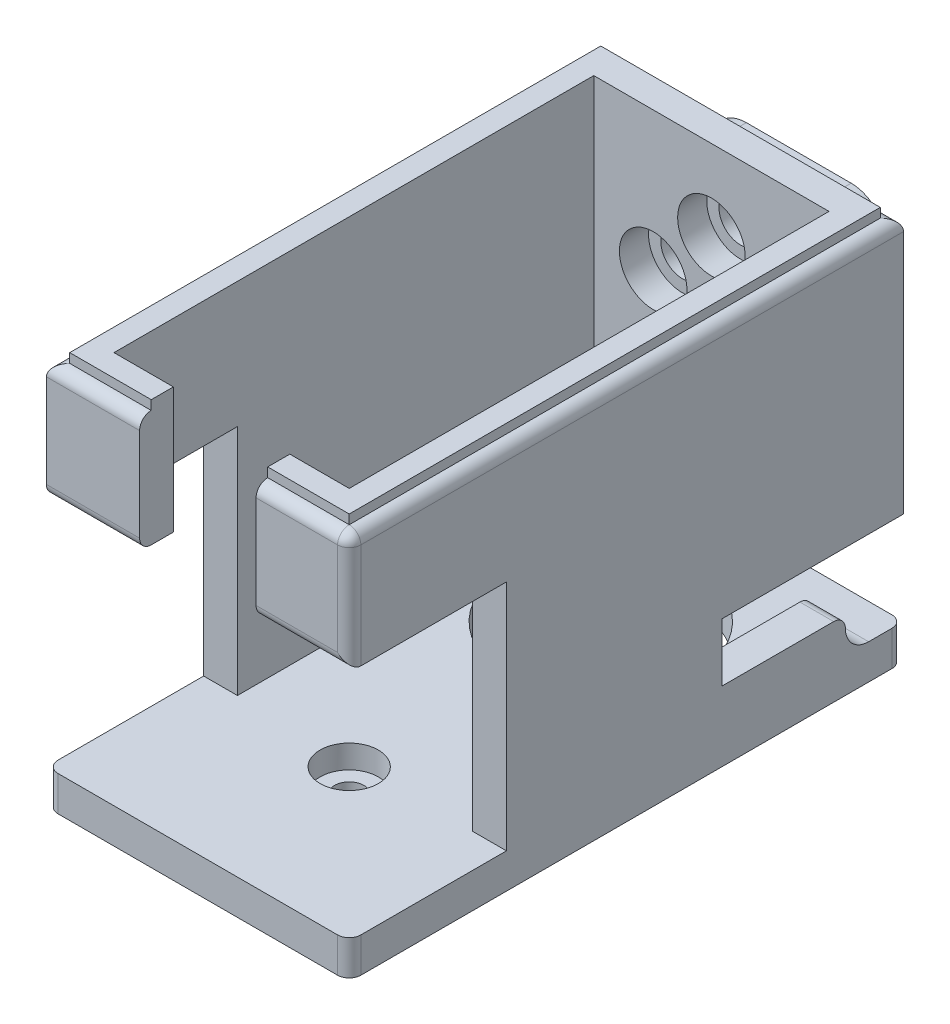
from build123d import *

# Parameters (mm, degrees)
BOSS_EXTRUDE1_DEPTH      = 10
SKETCH2_W                = 20
SKETCH2_H                = 17
BOSS_EXTRUDE2_DEPTH      = 3
SKETCH3_W                = 26
SKETCH3_H                = 47
BOSS_EXTRUDE3_DEPTH      = 3
SKETCH5_R                = 8
SKETCH5_W                = 16
SKETCH5_H                = 4
CUT_EXTRUDE1_DEPTH       = 41.264748851
BOSS_EXTRUDE4_DEPTH      = 26
SKETCH7_W                = 20
SKETCH7_H                = 10.5
CUT_EXTRUDE2_DEPTH       = 10
SKETCH9_W                = 8
SKETCH9_H                = 6
CUT_EXTRUDE3_DEPTH       = 10
SKETCH10_W               = 30
SKETCH10_H               = 30
BOSS_EXTRUDE5_DEPTH      = 3
SKETCH11_R               = 1.75
CUT_EXTRUDE4_DEPTH       = 5
BOSS_EXTRUDE6_START      = 3
SKETCH12_W               = 26
SKETCH12_H               = 47
SKETCH12_R               = 8
BOSS_EXTRUDE6_DEPTH      = 3
CUT_EXTRUDE5_START       = -3
SKETCH14_R               = 8
SKETCH14_W               = 16
SKETCH14_H               = 4
CUT_EXTRUDE5_DEPTH       = 3
CUT_EXTRUDE7_DEPTH       = 49.674942219
CUT_EXTRUDE7_DEPTH_BACK  = 49.674942219
BOSS_EXTRUDE7_DEPTH      = 10.7
SKETCH18_W               = 15
SKETCH18_H               = 5
CUT_EXTRUDE8_DEPTH       = 10
SKETCH21_R               = 1.85
CUT_EXTRUDE9_DEPTH       = 5
SKETCH22_R               = 2.9
CUT_EXTRUDE10_DEPTH      = 2.6
BOSS_EXTRUDE11_OUTLINE_R = 1.85
BOSS_EXTRUDE11_DEPTH     = 0.6
SKETCH24_R               = 1.85
BOSS_EXTRUDE12_DEPTH     = 4
SKETCH25_W               = 7
SKETCH25_H               = 3
CUT_EXTRUDE11_DEPTH      = 5
SKETCH26_W               = 20.2
SKETCH26_H               = 41.2
CUT_EXTRUDE12_DEPTH      = 30
SKETCH27_W               = 0.1
SKETCH27_H               = 3
CUT_EXTRUDE13_DEPTH      = 55.440426156
SKETCH28_R               = 8
CUT_EXTRUDE14_DEPTH      = 46.250524859
SKETCH29_W               = 2.9
SKETCH29_H               = 3
CUT_EXTRUDE15_DEPTH      = 5
FILLET1_R                = 2
FILLET2_R                = 2
FILLET3_R                = 1
BOSS_EXTRUDE13_START     = -5
SKETCH35_R               = 8
SKETCH35_R_2             = 2.5
BOSS_EXTRUDE13_DEPTH     = 5
BOSS_EXTRUDE14_DEPTH     = 0.8
SKETCH38_R               = 2.55
SKETCH38_R_2             = 2.5
CUT_EXTRUDE16_DEPTH      = 2
SKETCH39_R               = 2.55
SKETCH39_R_2             = 1.25
BOSS_EXTRUDE15_DEPTH     = 1
SKETCH40_R               = 8
SKETCH40_R_2             = 6.5
CUT_EXTRUDE17_DEPTH      = 4


# Read off the part's stored shape, not the designer's step: Boss-Extrude11
with BuildPart() as part:
    # Sketch1 → Boss-Extrude1 (new body)
    with BuildSketch(Plane(origin=(0, 0, 0), x_dir=(1, 0, 0), z_dir=(0, 1, 0))):
        Polygon((5, -23.5), (13, -23.5), (13, 23.5), (-13, 23.5), (-13, -23.5), (-5, -23.5), (-5, -20.5), (-10, -20.5), (-10, 20.5), (10, 20.5), (10, -20.5), (5, -20.5), align=None)
    extrude(amount=BOSS_EXTRUDE1_DEPTH)

    # Sketch2 → Boss-Extrude2 (add)
    with BuildSketch(Plane(origin=(13, 0, 0), x_dir=(0, 0, -1), z_dir=(1, 0, 0))):
        with Locations((0, -8.5)):
            Rectangle(SKETCH2_W, SKETCH2_H)
    boss_extrude2 = extrude(amount=-BOSS_EXTRUDE2_DEPTH)

    # Mirror1: Boss-Extrude2 across plane
    add(boss_extrude2.mirror(Plane(origin=(0, 0, 0), x_dir=(0, 0, 1), z_dir=(1, 0, 0))))

    # Sketch3 → Boss-Extrude3 (add)
    with BuildSketch(Plane.XZ.offset(17)):
        Rectangle(SKETCH3_W, SKETCH3_H)
    extrude(amount=BOSS_EXTRUDE3_DEPTH)

    # Sketch5 → Cut-Extrude1 (cut, through all)
    with BuildSketch(Plane.XZ.offset(20)):
        with Locations(Location((0, 10.5, 0), (0, 0, 270))):
            Circle(SKETCH5_R)
        with Locations((0, -6.5)):
            Rectangle(SKETCH5_W, SKETCH5_H)
        with Locations((0, -14.5)):
            Rectangle(SKETCH5_W, SKETCH5_H)
    extrude(amount=-CUT_EXTRUDE1_DEPTH, mode=Mode.SUBTRACT)

    # Sketch6 → Boss-Extrude4 (add)
    with BuildSketch(Plane(origin=(13, 0, 0), x_dir=(0, 0, -1), z_dir=(1, 0, 0))):
        Polygon((29.5, 4.35), (23.5, 4.35), (23.5, 0), (23.5, -3.65), (29.5, -3.65), align=None)
        Polygon((23.5, -3.65), (23.5, 0), (10, 0), (10, -9.3), (23.5, -9.3), align=None)
    extrude(amount=-BOSS_EXTRUDE4_DEPTH)

    # Sketch7 → Cut-Extrude2 (cut)
    with BuildSketch(Plane(origin=(0, 0, 0), x_dir=(1, 0, 0), z_dir=(0, 1, 0))):
        with Locations((0, 15.25)):
            Rectangle(SKETCH7_W, SKETCH7_H)
    extrude(amount=-CUT_EXTRUDE2_DEPTH, mode=Mode.SUBTRACT)

    # Sketch9 → Cut-Extrude3 (cut)
    with BuildSketch(Plane(origin=(0, 4.35, 0), x_dir=(1, 0, 0), z_dir=(0, 1, 0))):
        with Locations((-9, 26.5)):
            Rectangle(SKETCH9_W, SKETCH9_H)
        with Locations((9, 26.5)):
            Rectangle(SKETCH9_W, SKETCH9_H)
    extrude(amount=-CUT_EXTRUDE3_DEPTH, mode=Mode.SUBTRACT)

    # Sketch10 → Boss-Extrude5 (add)
    with BuildSketch(Plane(origin=(0, 0, -29.5), x_dir=(-1, 0, 0), z_dir=(0, 0, -1))):
        Rectangle(SKETCH10_W, SKETCH10_H)
    extrude(amount=BOSS_EXTRUDE5_DEPTH)

    # Sketch11 → Cut-Extrude4 (cut)
    with BuildSketch(Plane(origin=(0, 0, -32.5), x_dir=(-1, 0, 0), z_dir=(0, 0, -1))):
        with Locations((0, 10)):
            Circle(SKETCH11_R)
        with Locations((10, 0)):
            Circle(SKETCH11_R)
        with Locations((0, -10)):
            Circle(SKETCH11_R)
        with Locations((-10, 0)):
            Circle(SKETCH11_R)
    extrude(amount=-CUT_EXTRUDE4_DEPTH, mode=Mode.SUBTRACT)

    # Sketch12 → Boss-Extrude6 (add)
    with BuildSketch(Plane.XZ.offset(20).offset(BOSS_EXTRUDE6_START)):
        Rectangle(SKETCH12_W, SKETCH12_H)
        with Locations(Location((0, 10.5, 0), (0, 0, 270))):
            Circle(SKETCH12_R, mode=Mode.SUBTRACT)
    extrude(amount=-BOSS_EXTRUDE6_DEPTH)

    # Sketch14 → Cut-Extrude5 (cut)
    with BuildSketch(Plane(origin=(0, -17, 0), x_dir=(1, 0, 0), z_dir=(0, 1, 0)).offset(CUT_EXTRUDE5_START)):
        Polygon((13, -23.5), (13, -10), (10, -10), (10, 10), (13, 10), (13, 23.5), (-13, 23.5), (-13, 10), (-10, 10), (-10, -10), (-13, -10), (-13, -23.5), align=None)
        with Locations(Location((0, -10.5, 0), (0, 0, 90))):
            Circle(SKETCH14_R, mode=Mode.SUBTRACT)
        with Locations((0, 6.5)):
            Rectangle(SKETCH14_W, SKETCH14_H, mode=Mode.SUBTRACT)
        with Locations((0, 14.5)):
            Rectangle(SKETCH14_W, SKETCH14_H, mode=Mode.SUBTRACT)
    extrude(amount=CUT_EXTRUDE5_DEPTH, mode=Mode.SUBTRACT)

    # Sketch15 → Cut-Extrude7 (cut, two sides: drawn at the far end of the back side and taken through both)
    with BuildSketch(Plane(origin=(13, 0, 0), x_dir=(0, 0, -1), z_dir=(1, 0, 0)).offset(-CUT_EXTRUDE7_DEPTH_BACK)):
        Polygon((23.5, -9.3), (23.5, -15.243835525), (32.5, -15.243835525), (32.5, 15), (23.5, 15), (23.5, 10), align=None)
    extrude(amount=CUT_EXTRUDE7_DEPTH + CUT_EXTRUDE7_DEPTH_BACK, mode=Mode.SUBTRACT)

    # Sketch16 → Boss-Extrude7 (add)
    with BuildSketch(Plane.XZ.offset(9.3)):
        Polygon((10, -10), (10, -20.5), (-10, -20.5), (-10, -10), (-13, -10), (-13, -23.5), (13, -23.5), (13, -10), align=None)
    extrude(amount=BOSS_EXTRUDE7_DEPTH)

    # Sketch18 → Cut-Extrude8 (cut)
    with BuildSketch(Plane(origin=(13, 0, 0), x_dir=(0, 0, -1), z_dir=(1, 0, 0))):
        with Locations((16, -14.5)):
            Rectangle(SKETCH18_W, SKETCH18_H)
    cut_extrude8 = extrude(amount=-CUT_EXTRUDE8_DEPTH, mode=Mode.SUBTRACT)

    # Mirror2: Cut-Extrude8 across plane
    add(cut_extrude8.mirror(Plane(origin=(0, 0, 0), x_dir=(0, 0, 1), z_dir=(1, 0, 0))), mode=Mode.SUBTRACT)

    # Sketch21 → Cut-Extrude9 (cut)
    with BuildSketch(Plane(origin=(0, 0, -23.5), x_dir=(-1, 0, 0), z_dir=(0, 0, -1))):
        with Locations((-5, -1.15)):
            Circle(SKETCH21_R)
        with Locations((0, 3.85)):
            Circle(SKETCH21_R)
        with Locations((5, -1.15)):
            Circle(SKETCH21_R)
        with Locations((0, -6.15)):
            Circle(SKETCH21_R)
    extrude(amount=-CUT_EXTRUDE9_DEPTH, mode=Mode.SUBTRACT)

    # Sketch22 → Cut-Extrude10 (cut)
    with BuildSketch(Plane.XY.offset(-20.5)):
        with Locations((0, 3.85)):
            Circle(SKETCH22_R)
        with Locations((5, -1.15)):
            Circle(SKETCH22_R)
        with Locations((0, -6.15)):
            Circle(SKETCH22_R)
        with Locations((-5, -1.15)):
            Circle(SKETCH22_R)
    extrude(amount=-CUT_EXTRUDE10_DEPTH, mode=Mode.SUBTRACT)

    # Boss-Extrude11 outline → Boss-Extrude11 (add)
    with BuildSketch(Plane(origin=(0, 0, -23.5), x_dir=(-1, 0, 0), z_dir=(0, 0, -1))):
        Polygon((-13, -12), (-3, -12), (-3, -17), (-13, -17), (-13, -23), (13, -23), (13, -17), (3, -17), (3, -12), (13, -12), (13, 10), (-13, 10), align=None)
        with Locations((-5, -1.15)):
            Circle(BOSS_EXTRUDE11_OUTLINE_R, mode=Mode.SUBTRACT)
        with Locations((0, -6.15)):
            Circle(BOSS_EXTRUDE11_OUTLINE_R, mode=Mode.SUBTRACT)
        with Locations((5, -1.15)):
            Circle(BOSS_EXTRUDE11_OUTLINE_R, mode=Mode.SUBTRACT)
        with Locations((0, 3.85)):
            Circle(BOSS_EXTRUDE11_OUTLINE_R, mode=Mode.SUBTRACT)
    extrude(amount=BOSS_EXTRUDE11_DEPTH)

    # Sketch24 → Boss-Extrude12 (add)
    with BuildSketch(Plane(origin=(0, 0, -24.1), x_dir=(-1, 0, 0), z_dir=(0, 0, -1))):
        with BuildLine():
            ThreePointArc((-7.5, 3.35), (-6.621320344, 5.471320344), (-4.5, 6.35))
            Line((-4.5, 6.35), (4.5, 6.35))
            ThreePointArc((4.5, 6.35), (6.621320344, 5.471320344), (7.5, 3.35))
            Line((7.5, 3.35), (7.5, -5.65))
            ThreePointArc((7.5, -5.65), (6.621320344, -7.771320344), (4.5, -8.65))
            Line((4.5, -8.65), (-4.5, -8.65))
            ThreePointArc((-4.5, -8.65), (-6.621320344, -7.771320344), (-7.5, -5.65))
            Line((-7.5, -5.65), (-7.5, 3.35))
        make_face()
        with Locations((0, -6.15)):
            Circle(SKETCH24_R, mode=Mode.SUBTRACT)
        with Locations((5, -1.15)):
            Circle(SKETCH24_R, mode=Mode.SUBTRACT)
        with Locations((-5, -1.15)):
            Circle(SKETCH24_R, mode=Mode.SUBTRACT)
        with Locations((0, 3.85)):
            Circle(SKETCH24_R, mode=Mode.SUBTRACT)
    extrude(amount=BOSS_EXTRUDE12_DEPTH)

    # Sketch25 → Cut-Extrude11 (cut)
    with BuildSketch(Plane(origin=(0, 0, -24.1), x_dir=(-1, 0, 0), z_dir=(0, 0, -1))):
        with Locations((-6.5, -18.5)):
            Rectangle(SKETCH25_W, SKETCH25_H)
        with Locations((6.5, -18.5)):
            Rectangle(SKETCH25_W, SKETCH25_H)
    extrude(amount=-CUT_EXTRUDE11_DEPTH, mode=Mode.SUBTRACT)

    # Sketch26 → Cut-Extrude12 (cut)
    with BuildSketch(Plane(origin=(0, 10, 0), x_dir=(1, 0, 0), z_dir=(0, 1, 0))):
        Rectangle(SKETCH26_W, SKETCH26_H)
    extrude(amount=-CUT_EXTRUDE12_DEPTH, mode=Mode.SUBTRACT)

    # Sketch27 → Cut-Extrude13 (cut, through all)
    with BuildSketch(Plane(origin=(0, 0, -24.1), x_dir=(-1, 0, 0), z_dir=(0, 0, -1))):
        with Locations((-10.05, -18.5)):
            Rectangle(SKETCH27_W, SKETCH27_H)
        with Locations((10.05, -18.5)):
            Rectangle(SKETCH27_W, SKETCH27_H)
    extrude(amount=-CUT_EXTRUDE13_DEPTH, mode=Mode.SUBTRACT)

    # Sketch28 → Cut-Extrude14 (cut, through all)
    with BuildSketch(Plane.XZ.offset(23)):
        with Locations(Location((0, -11.1, 0), (0, 0, 270))):
            Circle(SKETCH28_R)
    extrude(amount=-CUT_EXTRUDE14_DEPTH, mode=Mode.SUBTRACT)

    # Sketch29 → Cut-Extrude15 (cut)
    with BuildSketch(Plane(origin=(0, 0, -24.1), x_dir=(-1, 0, 0), z_dir=(0, 0, -1))):
        with Locations((-11.55, -18.5)):
            Rectangle(SKETCH29_W, SKETCH29_H)
        with Locations((11.55, -18.5)):
            Rectangle(SKETCH29_W, SKETCH29_H)
    extrude(amount=-CUT_EXTRUDE15_DEPTH, mode=Mode.SUBTRACT)

    # Fillet1
    fillet1_edges = [part.edges().sort_by_distance(p)[0] for p in [
        (-3, -20, -22.35),
        (3, -20, -22.35),
    ]]
    fillet(fillet1_edges, radius=FILLET1_R)

    # Fillet2
    fillet2_edges = [part.edges().sort_by_distance(p)[0] for p in [
        (11.55, -20, -19.1),
        (-11.55, -20, -19.1),
    ]]
    fillet(fillet2_edges, radius=FILLET2_R)

    # Fillet3
    fillet3_edges = [part.edges().sort_by_distance(p)[0] for p in [
        (11.55, -17, -19.1),
        (-11.55, -17, -19.1),
        (-9, 10, 23.5),
        (-13, 10, -0.3),
        (0, 10, -24.1),
        (13, 10, -0.3),
        (9, 10, 23.5),
        (13, 5, 23.5),
        (9, 0, 23.5),
        (-9, 0, 23.5),
        (13, -21.5, -24.1),
        (-13, -21.5, -24.1),
        (-13, -21.5, 23.5),
        (13, -21.5, 23.5),
    ]]
    fillet(fillet3_edges, radius=FILLET3_R - 0.0001)  # a hair under: the kernel refuses the full size

    # Sketch35 → Boss-Extrude13 (add)
    with BuildSketch(Plane(origin=(0, -20, 0), x_dir=(1, 0, 0), z_dir=(0, 1, 0)).offset(BOSS_EXTRUDE13_START)):
        with Locations(Location((0, -10.5, 0), (0, 0, 270))):
            Circle(SKETCH35_R)
        with Locations(Location((0, -10.5, 0), (0, 0, 270))):
            Circle(SKETCH35_R_2, mode=Mode.SUBTRACT)
    extrude(amount=BOSS_EXTRUDE13_DEPTH)

    # Sketch36 → Boss-Extrude14 (add)
    with BuildSketch(Plane(origin=(0, 10, 0), x_dir=(1, 0, 0), z_dir=(0, 1, 0))):
        Polygon((12, 23.1), (-12, 23.1), (-12, -22.5), (-5, -22.5), (-5, -20.6), (-10.1, -20.6), (-10.1, 20.6), (10.1, 20.6), (10.1, -20.6), (5, -20.6), (5, -22.5), (12, -22.5), align=None)
    extrude(amount=BOSS_EXTRUDE14_DEPTH)

    # Sketch38 → Cut-Extrude16 (cut)
    with BuildSketch(Plane.XZ.offset(25)):
        with Locations(Location((0, 10.5, 0), (0, 0, 270))):
            Circle(SKETCH38_R)
        with Locations(Location((0, 10.5, 0), (0, 0, 90))):
            Circle(SKETCH38_R_2, mode=Mode.SUBTRACT)
    extrude(amount=-CUT_EXTRUDE16_DEPTH, mode=Mode.SUBTRACT)

    # Sketch39 → Boss-Extrude15 (add)
    with BuildSketch(Plane.XZ.offset(23)):
        with Locations(Location((0, 10.5, 0), (0, 0, 270))):
            Circle(SKETCH39_R)
        with Locations(Location((0, 10.5, 0), (0, 0, 270))):
            Circle(SKETCH39_R_2, mode=Mode.SUBTRACT)
    extrude(amount=-BOSS_EXTRUDE15_DEPTH)

    # Sketch40 → Cut-Extrude17 (cut)
    with BuildSketch(Plane.XZ.offset(25)):
        with Locations(Location((0, 10.5, 0), (0, 0, 270))):
            Circle(SKETCH40_R)
        with Locations(Location((0, 10.5, 0), (0, 0, 270))):
            Circle(SKETCH40_R_2, mode=Mode.SUBTRACT)
    extrude(amount=-CUT_EXTRUDE17_DEPTH, mode=Mode.SUBTRACT)


solid = part.part
